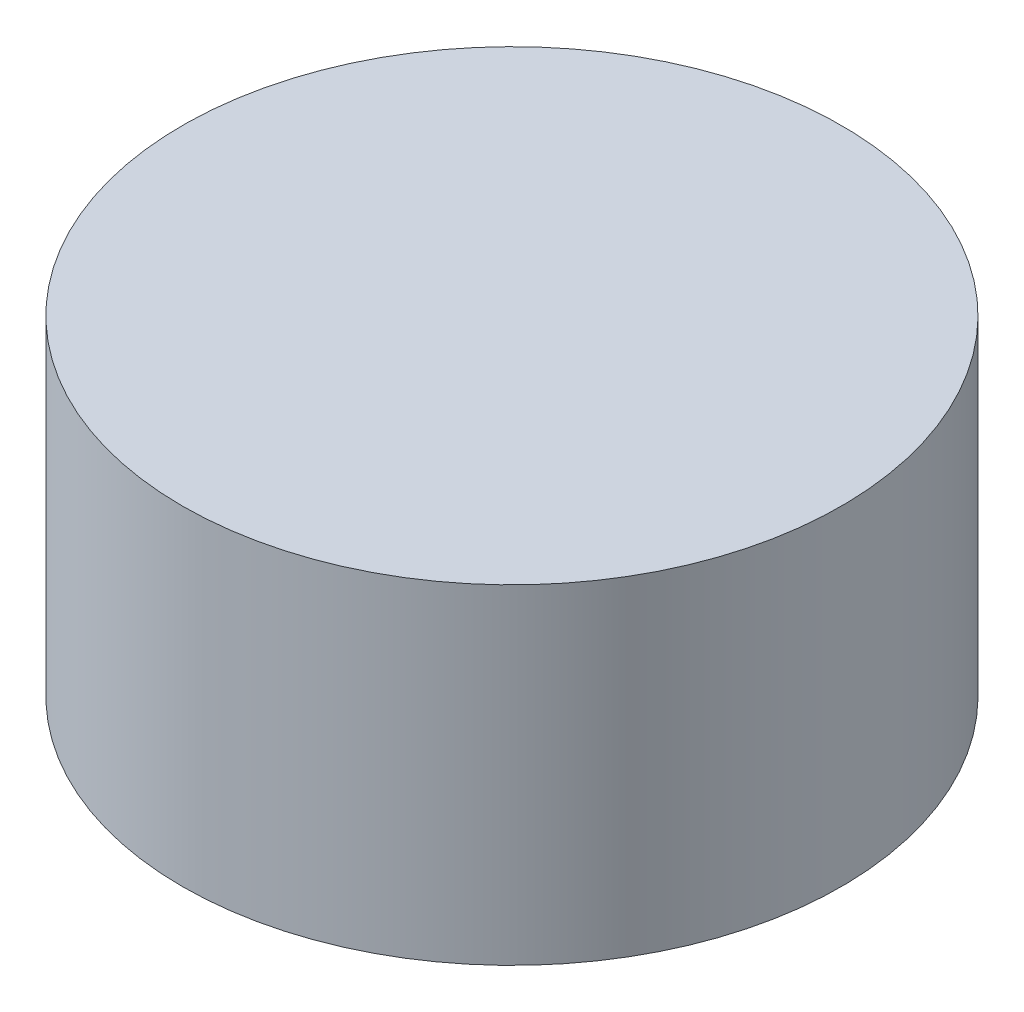
from build123d import *

# Parameters (mm, degrees)
SKETCH1_R           = 2
BOSS_EXTRUDE1_DEPTH = 2


with BuildPart() as part:
    # Sketch1 → Boss-Extrude1 (new body)
    with BuildSketch(Plane(origin=(0, 0, 0), x_dir=(1, 0, 0), z_dir=(0, 1, 0))):
        Circle(SKETCH1_R)
    extrude(amount=BOSS_EXTRUDE1_DEPTH)


solid = part.part
